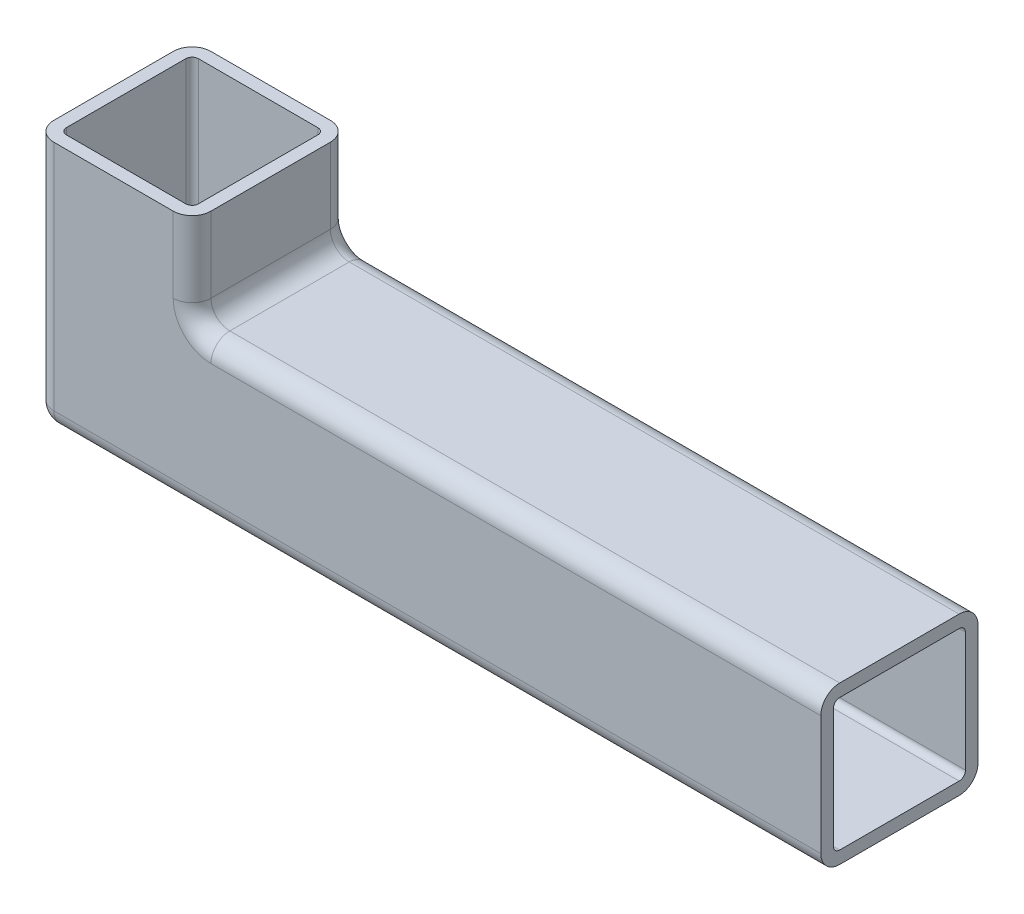
from build123d import *

# Parameters (mm, degrees)
SKETCH1_W           = 125
SKETCH1_H           = 40
BOSS_EXTRUDE1_DEPTH = 25
SKETCH2_W           = 100
SKETCH2_H           = 15
CUT_EXTRUDE1_DEPTH  = 25
SKETCH3_W           = 21
SKETCH3_H           = 21
CUT_EXTRUDE2_DEPTH  = 123
SKETCH4_W           = 21
SKETCH4_H           = 21
CUT_EXTRUDE3_DEPTH  = 38
FILLET3_R           = 1
FILLET4_R           = 1
FILLET5_R           = 1
FILLET6_R           = 1
FILLET7_R           = 1
FILLET8_R           = 1
FILLET9_R           = 3
FILLET11_R          = 3
FILLET12_R          = 3


with BuildPart() as part:
    # Sketch1 → Boss-Extrude1 (new body)
    with BuildSketch(Plane.XY):
        with Locations((62.5, 20)):
            Rectangle(SKETCH1_W, SKETCH1_H)
    extrude(amount=BOSS_EXTRUDE1_DEPTH)

    # Sketch2 → Cut-Extrude1 (cut)
    with BuildSketch(Plane.XY.offset(25)):
        with Locations((75, 32.5)):
            Rectangle(SKETCH2_W, SKETCH2_H)
    extrude(amount=-CUT_EXTRUDE1_DEPTH, mode=Mode.SUBTRACT)

    # Sketch3 → Cut-Extrude2 (cut)
    with BuildSketch(Plane(origin=(125, 0, 0), x_dir=(0, 0, -1), z_dir=(1, 0, 0))):
        with Locations((-12.5, 12.5)):
            Rectangle(SKETCH3_W, SKETCH3_H)
    extrude(amount=-CUT_EXTRUDE2_DEPTH, mode=Mode.SUBTRACT)

    # Sketch4 → Cut-Extrude3 (cut)
    with BuildSketch(Plane(origin=(0, 40, 0), x_dir=(1, 0, 0), z_dir=(0, 1, 0))):
        with Locations((12.5, -12.5)):
            Rectangle(SKETCH4_W, SKETCH4_H)
    extrude(amount=-CUT_EXTRUDE3_DEPTH, mode=Mode.SUBTRACT)

    # Fillet3
    fillet3_edges = [part.edges().sort_by_distance(p)[0] for p in [
        (2, 21, 2),
        (63.5, 2, 2),
    ]]
    fillet(fillet3_edges, radius=FILLET3_R)

    # Fillet4
    fillet4_edges = [part.edges().sort_by_distance(p)[0] for p in [
        (2, 21, 23),
        (63.5, 2, 23),
    ]]
    fillet(fillet4_edges, radius=FILLET4_R)

    # Fillet5
    fillet5_edges = [part.edges().sort_by_distance(p)[0] for p in [
        (74, 23, 2),
    ]]
    fillet(fillet5_edges, radius=FILLET5_R)

    # Fillet6
    fillet6_edges = [part.edges().sort_by_distance(p)[0] for p in [
        (74, 23, 23),
    ]]
    fillet(fillet6_edges, radius=FILLET6_R)

    # Fillet7
    fillet7_edges = [part.edges().sort_by_distance(p)[0] for p in [
        (23, 31, 23),
    ]]
    fillet(fillet7_edges, radius=FILLET7_R)

    # Fillet8
    fillet8_edges = [part.edges().sort_by_distance(p)[0] for p in [
        (23, 31, 2),
    ]]
    fillet(fillet8_edges, radius=FILLET8_R)

    # Fillet9
    fillet9_edges = [part.edges().sort_by_distance(p)[0] for p in [
        (25, 25, 12.5),
        (25, 32.5, 25),
        (75, 25, 25),
        (0, 20, 25),
        (62.5, 0, 25),
    ]]
    fillet(fillet9_edges, radius=FILLET9_R)

    # Fillet11
    fillet11_edges = [part.edges().sort_by_distance(p)[0] for p in [
        (76.5, 25, 0),
        (25.878679656, 25.878679656, 0),
        (25, 34, 0),
        (62.5, 0, 0),
        (0, 20, 0),
    ]]
    fillet(fillet11_edges, radius=FILLET11_R)

    # Fillet12
    # the kernel refuses this fillet: 3 mm, written as the material it takes off along each edge
    with BuildSketch(Plane(origin=(3, 3, 22), x_dir=(-1, 0, 0), z_dir=(0, -1, 0))) as fillet12_piece_1_section:
        Polygon((0, 0), (FILLET12_R, 0), (FILLET12_R, -FILLET12_R), (0, -FILLET12_R), align=None)
    fillet12_piece_1 = extrude(amount=FILLET12_R, mode=Mode.PRIVATE)
    fillet12_piece_1 = fillet12_piece_1 - Plane(origin=(3, 3, 22), x_dir=(0.7071067811865475, 0, -0.7071067811865475), z_dir=(0, -1, 0)) * Sphere(FILLET12_R, mode=Mode.PRIVATE)
    add(fillet12_piece_1, mode=Mode.SUBTRACT)
    with BuildSketch(Plane(origin=(3, 3, 3), x_dir=(-1, 0, 0), z_dir=(0, -1, 0))) as fillet12_piece_2_section:
        Polygon((0, 0), (FILLET12_R, 0), (FILLET12_R, FILLET12_R), (0, FILLET12_R), align=None)
    fillet12_piece_2 = extrude(amount=FILLET12_R, mode=Mode.PRIVATE)
    fillet12_piece_2 = fillet12_piece_2 - Plane(origin=(3, 3, 3), x_dir=(0.7071067811865475, 0, 0.7071067811865475), z_dir=(0, -1, 0)) * Sphere(FILLET12_R, mode=Mode.PRIVATE)
    add(fillet12_piece_2, mode=Mode.SUBTRACT)
    with BuildSketch(Plane(origin=(0, 0, 3), x_dir=(1, 0, 0), z_dir=(0, 0, 1))) as fillet12_piece_3:
        with BuildLine():
            CenterArc((FILLET12_R, FILLET12_R), FILLET12_R, 180, 90)
            Line((0, FILLET12_R), (0, 0))
            Line((0, 0), (FILLET12_R, 0))
        make_face()
    extrude(amount=19, mode=Mode.SUBTRACT)


solid = part.part
